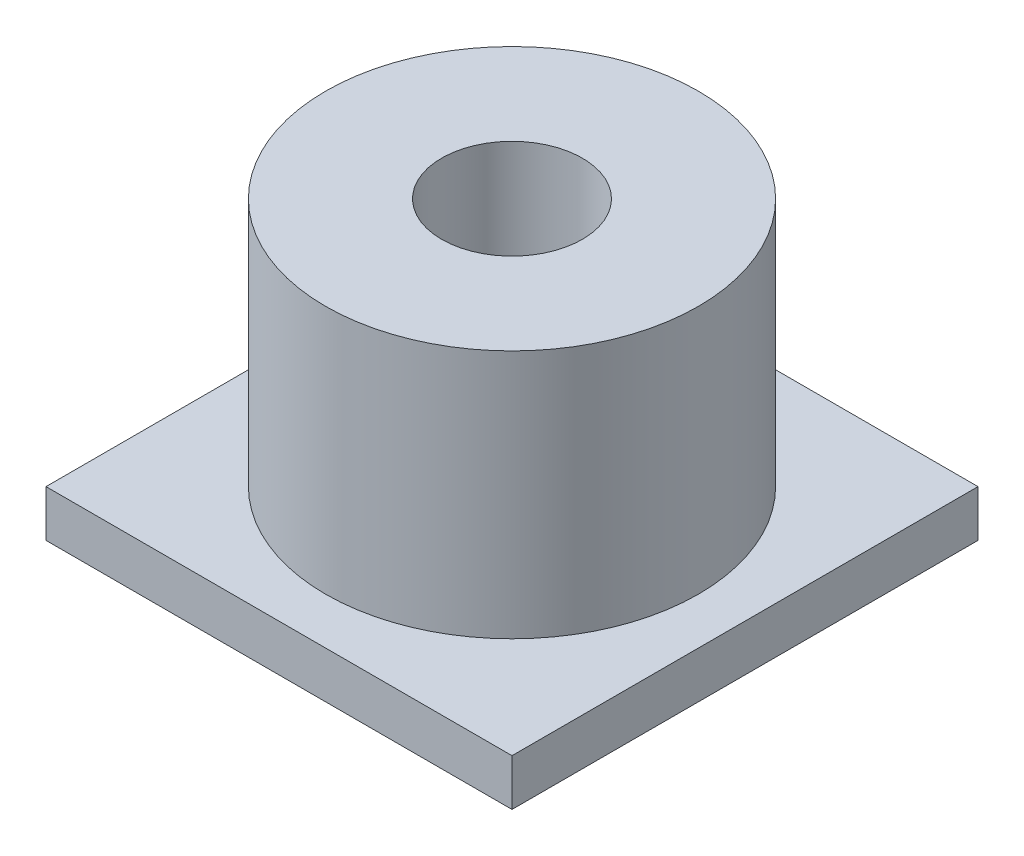
from build123d import *

# Parameters (mm, degrees)
SKETCH1_W           = 10
SKETCH1_H           = 10
SKETCH1_R           = 1.25
BOSS_EXTRUDE1_DEPTH = 1
SKETCH2_R           = 4
SKETCH2_R_2         = 1.51
BOSS_EXTRUDE2_DEPTH = 5.35


with BuildPart() as part:
    # Sketch1 → Boss-Extrude1 (new body)
    with BuildSketch(Plane(origin=(0, 0, 0), x_dir=(1, 0, 0), z_dir=(0, 1, 0))):
        with Locations((5, -5)):
            Rectangle(SKETCH1_W, SKETCH1_H)
        with Locations((5, -5)):
            Circle(SKETCH1_R, mode=Mode.SUBTRACT)
    extrude(amount=BOSS_EXTRUDE1_DEPTH)

    # Sketch2 → Boss-Extrude2 (add)
    with BuildSketch(Plane(origin=(0, 1, 0), x_dir=(1, 0, 0), z_dir=(0, 1, 0))):
        with Locations((5, -5)):
            Circle(SKETCH2_R)
        with Locations((5, -5)):
            Circle(SKETCH2_R_2, mode=Mode.SUBTRACT)
    extrude(amount=BOSS_EXTRUDE2_DEPTH)


solid = part.part
